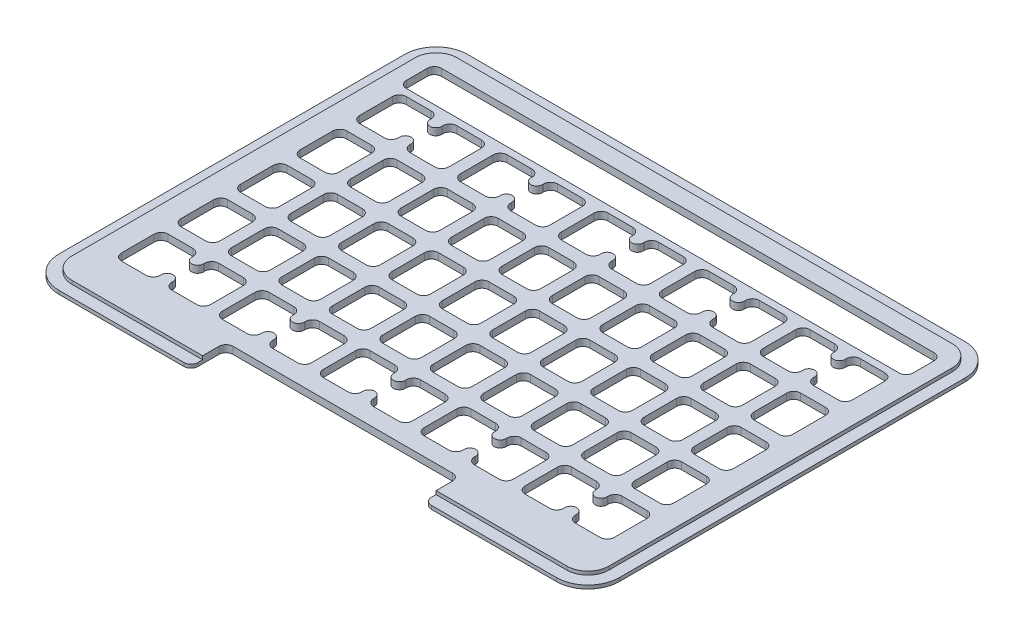
from build123d import *

# Parameters (mm, degrees)
SKETCH1_W                = 240
SKETCH1_H                = 175
OUTER_PROFILE_DEPTH      = 1.5
SKETCH2_W                = 230
SKETCH2_H                = 165
INNER_PROFILE_DEPTH      = 1.5
FILLET1_R                = 9
FILLET2_R                = 13.5
SKETCH3_W                = 16.6
SKETCH3_H                = 20
CUTOUT_DEPTH             = 149.543764595
CORNERS_R                = 3
CUTOUTS_COUNT            = 5
CUTOUTS_PITCH            = 21.6
CUTOUTS_COUNT_DIR2       = 5
CUTOUTS_PITCH_DIR2       = 25.5
CORNERS_OF_CUTOUTS_R     = 3
MIRROR1_DEPTH            = 3
SKETCH4_W                = 217
SKETCH4_H                = 15
MESSAGE_WINDOW_DEPTH     = 149.543764595
MESSAGE_WINDOW_CORNERS_R = 3
CELL_SPLIT_DEPTH         = 149.543764595
CELL_SPLITS_COUNT        = 5
CELL_SPLITS_PITCH        = 43.2
CELL_SPLITS_COUNT_DIR2   = 2
CELL_SPLITS_PITCH_DIR2   = 102
SKETCH6_W                = 100
SKETCH6_H                = 15
BASE_CUTBACK_DEPTH       = 149.543764595
FILLET5_R                = 3


# Read off the part's stored shape, not the designer's step: Mirror1
with BuildPart() as part:
    # Sketch1 → Outer Profile (new body)
    with BuildSketch(Plane(origin=(0, 0, 0), x_dir=(1, 0, 0), z_dir=(0, 1, 0))):
        Rectangle(SKETCH1_W, SKETCH1_H)
    extrude(amount=OUTER_PROFILE_DEPTH)

    # Sketch2 → Inner Profile (add)
    with BuildSketch(Plane(origin=(0, 1.5, 0), x_dir=(1, 0, 0), z_dir=(0, 1, 0))):
        Rectangle(SKETCH2_W, SKETCH2_H)
    extrude(amount=INNER_PROFILE_DEPTH)

    # Fillet1
    fillet1_edges = [part.edges().sort_by_distance(p)[0] for p in [
        (115, 2.25, 82.5),
        (115, 2.25, -82.5),
        (-115, 2.25, -82.5),
        (-115, 2.25, 82.5),
    ]]
    fillet(fillet1_edges, radius=FILLET1_R)

    # Fillet2
    fillet2_edges = [part.edges().sort_by_distance(p)[0] for p in [
        (120, 0.75, 87.5),
        (-120, 0.75, 87.5),
        (-120, 0.75, -87.5),
        (120, 0.75, -87.5),
    ]]
    fillet(fillet2_edges, radius=FILLET2_R)

    # Sketch3 → Cutout (cut, through all)
    with BuildSketch(Plane(origin=(0, 3, 0), x_dir=(1, 0, 0), z_dir=(0, 1, 0))):
        with Locations((-10.8, -54.75)):
            Rectangle(SKETCH3_W, SKETCH3_H)
    cutout = extrude(amount=-CUTOUT_DEPTH, mode=Mode.SUBTRACT)

    # Corners
    corners_edges = [part.edges().sort_by_distance(p)[0] for p in [
        (-2.5, 1.5, 44.75),
        (-2.5, 1.5, 64.75),
        (-19.1, 1.5, 64.75),
        (-19.1, 1.5, 44.75),
    ]]
    fillet(corners_edges, radius=CORNERS_R)

    # Cutouts: Cutout 5 × 5
    with Locations(*[(-i * CUTOUTS_PITCH, 0, -j * CUTOUTS_PITCH_DIR2) for i in range(CUTOUTS_COUNT) for j in range(CUTOUTS_COUNT_DIR2) if (i, j) != (0, 0)]):
        add(cutout, mode=Mode.SUBTRACT)

    # Corners of Cutouts
    corners_of_cutouts_edges = [part.edges().sort_by_distance(p)[0] for p in [
        (-2.5, 1.5, 19.25),
        (-2.5, 1.5, 39.25),
        (-19.1, 1.5, 39.25),
        (-19.1, 1.5, 19.25),
        (-2.5, 1.5, -6.25),
        (-2.5, 1.5, 13.75),
        (-19.1, 1.5, 13.75),
        (-19.1, 1.5, -6.25),
        (-2.5, 1.5, -31.75),
        (-2.5, 1.5, -11.75),
        (-19.1, 1.5, -11.75),
        (-19.1, 1.5, -31.75),
        (-2.5, 1.5, -57.25),
        (-2.5, 1.5, -37.25),
        (-19.1, 1.5, -37.25),
        (-19.1, 1.5, -57.25),
        (-24.1, 1.5, 44.75),
        (-24.1, 1.5, 64.75),
        (-40.7, 1.5, 64.75),
        (-40.7, 1.5, 44.75),
        (-24.1, 1.5, 19.25),
        (-24.1, 1.5, 39.25),
        (-40.7, 1.5, 39.25),
        (-40.7, 1.5, 19.25),
        (-24.1, 1.5, -6.25),
        (-24.1, 1.5, 13.75),
        (-40.7, 1.5, 13.75),
        (-40.7, 1.5, -6.25),
        (-24.1, 1.5, -31.75),
        (-24.1, 1.5, -11.75),
        (-40.7, 1.5, -11.75),
        (-40.7, 1.5, -31.75),
        (-24.1, 1.5, -57.25),
        (-24.1, 1.5, -37.25),
        (-40.7, 1.5, -37.25),
        (-40.7, 1.5, -57.25),
        (-45.7, 1.5, 44.75),
        (-45.7, 1.5, 64.75),
        (-62.3, 1.5, 64.75),
        (-62.3, 1.5, 44.75),
        (-45.7, 1.5, 19.25),
        (-45.7, 1.5, 39.25),
        (-62.3, 1.5, 39.25),
        (-62.3, 1.5, 19.25),
        (-45.7, 1.5, -6.25),
        (-45.7, 1.5, 13.75),
        (-62.3, 1.5, 13.75),
        (-62.3, 1.5, -6.25),
        (-45.7, 1.5, -31.75),
        (-45.7, 1.5, -11.75),
        (-62.3, 1.5, -11.75),
        (-62.3, 1.5, -31.75),
        (-45.7, 1.5, -57.25),
        (-45.7, 1.5, -37.25),
        (-62.3, 1.5, -37.25),
        (-62.3, 1.5, -57.25),
        (-67.3, 1.5, 44.75),
        (-67.3, 1.5, 64.75),
        (-83.9, 1.5, 64.75),
        (-83.9, 1.5, 44.75),
        (-67.3, 1.5, 19.25),
        (-67.3, 1.5, 39.25),
        (-83.9, 1.5, 39.25),
        (-83.9, 1.5, 19.25),
        (-67.3, 1.5, -6.25),
        (-67.3, 1.5, 13.75),
        (-83.9, 1.5, 13.75),
        (-83.9, 1.5, -6.25),
        (-67.3, 1.5, -31.75),
        (-67.3, 1.5, -11.75),
        (-83.9, 1.5, -11.75),
        (-83.9, 1.5, -31.75),
        (-67.3, 1.5, -57.25),
        (-67.3, 1.5, -37.25),
        (-83.9, 1.5, -37.25),
        (-83.9, 1.5, -57.25),
        (-88.9, 1.5, 44.75),
        (-88.9, 1.5, 64.75),
        (-105.5, 1.5, 64.75),
        (-105.5, 1.5, 44.75),
        (-88.9, 1.5, 19.25),
        (-88.9, 1.5, 39.25),
        (-105.5, 1.5, 39.25),
        (-105.5, 1.5, 19.25),
        (-88.9, 1.5, -6.25),
        (-88.9, 1.5, 13.75),
        (-105.5, 1.5, 13.75),
        (-105.5, 1.5, -6.25),
        (-88.9, 1.5, -31.75),
        (-88.9, 1.5, -11.75),
        (-105.5, 1.5, -11.75),
        (-105.5, 1.5, -31.75),
        (-88.9, 1.5, -57.25),
        (-88.9, 1.5, -37.25),
        (-105.5, 1.5, -37.25),
        (-105.5, 1.5, -57.25),
    ]]
    fillet(corners_of_cutouts_edges, radius=CORNERS_OF_CUTOUTS_R)

    # Mirror1 outline → Mirror1 (cut)
    with BuildSketch(Plane(origin=(0, 0, 0), x_dir=(1, 0, 0), z_dir=(0, 1, 0))):
        with BuildLine():
            Line((5.5, -64.75), (16.1, -64.75))
            ThreePointArc((16.1, -64.75), (18.221320344, -63.871320344), (19.1, -61.75))
            Line((19.1, -61.75), (19.1, -47.75))
            ThreePointArc((19.1, -47.75), (18.221320344, -45.628679656), (16.1, -44.75))
            Line((16.1, -44.75), (5.5, -44.75))
            ThreePointArc((5.5, -44.75), (3.378679656, -45.628679656), (2.5, -47.75))
            Line((2.5, -47.75), (2.5, -61.75))
            ThreePointArc((2.5, -61.75), (3.378679656, -63.871320344), (5.5, -64.75))
        make_face()
        with BuildLine():
            Line((27.1, -64.75), (37.7, -64.75))
            ThreePointArc((37.7, -64.75), (39.821320344, -63.871320344), (40.7, -61.75))
            Line((40.7, -61.75), (40.7, -47.75))
            ThreePointArc((40.7, -47.75), (39.821320344, -45.628679656), (37.7, -44.75))
            Line((37.7, -44.75), (27.1, -44.75))
            ThreePointArc((27.1, -44.75), (24.978679656, -45.628679656), (24.1, -47.75))
            Line((24.1, -47.75), (24.1, -61.75))
            ThreePointArc((24.1, -61.75), (24.978679656, -63.871320344), (27.1, -64.75))
        make_face()
        with BuildLine():
            Line((48.7, -64.75), (59.3, -64.75))
            ThreePointArc((59.3, -64.75), (61.421320344, -63.871320344), (62.3, -61.75))
            Line((62.3, -61.75), (62.3, -47.75))
            ThreePointArc((62.3, -47.75), (61.421320344, -45.628679656), (59.3, -44.75))
            Line((59.3, -44.75), (48.7, -44.75))
            ThreePointArc((48.7, -44.75), (46.578679656, -45.628679656), (45.7, -47.75))
            Line((45.7, -47.75), (45.7, -61.75))
            ThreePointArc((45.7, -61.75), (46.578679656, -63.871320344), (48.7, -64.75))
        make_face()
        with BuildLine():
            Line((70.3, -64.75), (80.9, -64.75))
            ThreePointArc((80.9, -64.75), (83.021320344, -63.871320344), (83.9, -61.75))
            Line((83.9, -61.75), (83.9, -47.75))
            ThreePointArc((83.9, -47.75), (83.021320344, -45.628679656), (80.9, -44.75))
            Line((80.9, -44.75), (70.3, -44.75))
            ThreePointArc((70.3, -44.75), (68.178679656, -45.628679656), (67.3, -47.75))
            Line((67.3, -47.75), (67.3, -61.75))
            ThreePointArc((67.3, -61.75), (68.178679656, -63.871320344), (70.3, -64.75))
        make_face()
        with BuildLine():
            Line((91.9, -64.75), (102.5, -64.75))
            ThreePointArc((102.5, -64.75), (104.621320344, -63.871320344), (105.5, -61.75))
            Line((105.5, -61.75), (105.5, -47.75))
            ThreePointArc((105.5, -47.75), (104.621320344, -45.628679656), (102.5, -44.75))
            Line((102.5, -44.75), (91.9, -44.75))
            ThreePointArc((91.9, -44.75), (89.778679656, -45.628679656), (88.9, -47.75))
            Line((88.9, -47.75), (88.9, -61.75))
            ThreePointArc((88.9, -61.75), (89.778679656, -63.871320344), (91.9, -64.75))
        make_face()
        with BuildLine():
            Line((5.5, -39.25), (16.1, -39.25))
            ThreePointArc((16.1, -39.25), (18.221320344, -38.371320344), (19.1, -36.25))
            Line((19.1, -36.25), (19.1, -22.25))
            ThreePointArc((19.1, -22.25), (18.221320344, -20.128679656), (16.1, -19.25))
            Line((16.1, -19.25), (5.5, -19.25))
            ThreePointArc((5.5, -19.25), (3.378679656, -20.128679656), (2.5, -22.25))
            Line((2.5, -22.25), (2.5, -36.25))
            ThreePointArc((2.5, -36.25), (3.378679656, -38.371320344), (5.5, -39.25))
        make_face()
        with BuildLine():
            Line((27.1, -39.25), (37.7, -39.25))
            ThreePointArc((37.7, -39.25), (39.821320344, -38.371320344), (40.7, -36.25))
            Line((40.7, -36.25), (40.7, -22.25))
            ThreePointArc((40.7, -22.25), (39.821320344, -20.128679656), (37.7, -19.25))
            Line((37.7, -19.25), (27.1, -19.25))
            ThreePointArc((27.1, -19.25), (24.978679656, -20.128679656), (24.1, -22.25))
            Line((24.1, -22.25), (24.1, -36.25))
            ThreePointArc((24.1, -36.25), (24.978679656, -38.371320344), (27.1, -39.25))
        make_face()
        with BuildLine():
            Line((48.7, -39.25), (59.3, -39.25))
            ThreePointArc((59.3, -39.25), (61.421320344, -38.371320344), (62.3, -36.25))
            Line((62.3, -36.25), (62.3, -22.25))
            ThreePointArc((62.3, -22.25), (61.421320344, -20.128679656), (59.3, -19.25))
            Line((59.3, -19.25), (48.7, -19.25))
            ThreePointArc((48.7, -19.25), (46.578679656, -20.128679656), (45.7, -22.25))
            Line((45.7, -22.25), (45.7, -36.25))
            ThreePointArc((45.7, -36.25), (46.578679656, -38.371320344), (48.7, -39.25))
        make_face()
        with BuildLine():
            Line((70.3, -39.25), (80.9, -39.25))
            ThreePointArc((80.9, -39.25), (83.021320344, -38.371320344), (83.9, -36.25))
            Line((83.9, -36.25), (83.9, -22.25))
            ThreePointArc((83.9, -22.25), (83.021320344, -20.128679656), (80.9, -19.25))
            Line((80.9, -19.25), (70.3, -19.25))
            ThreePointArc((70.3, -19.25), (68.178679656, -20.128679656), (67.3, -22.25))
            Line((67.3, -22.25), (67.3, -36.25))
            ThreePointArc((67.3, -36.25), (68.178679656, -38.371320344), (70.3, -39.25))
        make_face()
        with BuildLine():
            Line((91.9, -39.25), (102.5, -39.25))
            ThreePointArc((102.5, -39.25), (104.621320344, -38.371320344), (105.5, -36.25))
            Line((105.5, -36.25), (105.5, -22.25))
            ThreePointArc((105.5, -22.25), (104.621320344, -20.128679656), (102.5, -19.25))
            Line((102.5, -19.25), (91.9, -19.25))
            ThreePointArc((91.9, -19.25), (89.778679656, -20.128679656), (88.9, -22.25))
            Line((88.9, -22.25), (88.9, -36.25))
            ThreePointArc((88.9, -36.25), (89.778679656, -38.371320344), (91.9, -39.25))
        make_face()
        with BuildLine():
            Line((5.5, -13.75), (16.1, -13.75))
            ThreePointArc((16.1, -13.75), (18.221320344, -12.871320344), (19.1, -10.75))
            Line((19.1, -10.75), (19.1, 3.25))
            ThreePointArc((19.1, 3.25), (18.221320344, 5.371320344), (16.1, 6.25))
            Line((16.1, 6.25), (5.5, 6.25))
            ThreePointArc((5.5, 6.25), (3.378679656, 5.371320344), (2.5, 3.25))
            Line((2.5, 3.25), (2.5, -10.75))
            ThreePointArc((2.5, -10.75), (3.378679656, -12.871320344), (5.5, -13.75))
        make_face()
        with BuildLine():
            Line((27.1, -13.75), (37.7, -13.75))
            ThreePointArc((37.7, -13.75), (39.821320344, -12.871320344), (40.7, -10.75))
            Line((40.7, -10.75), (40.7, 3.25))
            ThreePointArc((40.7, 3.25), (39.821320344, 5.371320344), (37.7, 6.25))
            Line((37.7, 6.25), (27.1, 6.25))
            ThreePointArc((27.1, 6.25), (24.978679656, 5.371320344), (24.1, 3.25))
            Line((24.1, 3.25), (24.1, -10.75))
            ThreePointArc((24.1, -10.75), (24.978679656, -12.871320344), (27.1, -13.75))
        make_face()
        with BuildLine():
            Line((48.7, -13.75), (59.3, -13.75))
            ThreePointArc((59.3, -13.75), (61.421320344, -12.871320344), (62.3, -10.75))
            Line((62.3, -10.75), (62.3, 3.25))
            ThreePointArc((62.3, 3.25), (61.421320344, 5.371320344), (59.3, 6.25))
            Line((59.3, 6.25), (48.7, 6.25))
            ThreePointArc((48.7, 6.25), (46.578679656, 5.371320344), (45.7, 3.25))
            Line((45.7, 3.25), (45.7, -10.75))
            ThreePointArc((45.7, -10.75), (46.578679656, -12.871320344), (48.7, -13.75))
        make_face()
        with BuildLine():
            Line((70.3, -13.75), (80.9, -13.75))
            ThreePointArc((80.9, -13.75), (83.021320344, -12.871320344), (83.9, -10.75))
            Line((83.9, -10.75), (83.9, 3.25))
            ThreePointArc((83.9, 3.25), (83.021320344, 5.371320344), (80.9, 6.25))
            Line((80.9, 6.25), (70.3, 6.25))
            ThreePointArc((70.3, 6.25), (68.178679656, 5.371320344), (67.3, 3.25))
            Line((67.3, 3.25), (67.3, -10.75))
            ThreePointArc((67.3, -10.75), (68.178679656, -12.871320344), (70.3, -13.75))
        make_face()
        with BuildLine():
            Line((91.9, -13.75), (102.5, -13.75))
            ThreePointArc((102.5, -13.75), (104.621320344, -12.871320344), (105.5, -10.75))
            Line((105.5, -10.75), (105.5, 3.25))
            ThreePointArc((105.5, 3.25), (104.621320344, 5.371320344), (102.5, 6.25))
            Line((102.5, 6.25), (91.9, 6.25))
            ThreePointArc((91.9, 6.25), (89.778679656, 5.371320344), (88.9, 3.25))
            Line((88.9, 3.25), (88.9, -10.75))
            ThreePointArc((88.9, -10.75), (89.778679656, -12.871320344), (91.9, -13.75))
        make_face()
        with BuildLine():
            Line((5.5, 11.75), (16.1, 11.75))
            ThreePointArc((16.1, 11.75), (18.221320344, 12.628679656), (19.1, 14.75))
            Line((19.1, 14.75), (19.1, 28.75))
            ThreePointArc((19.1, 28.75), (18.221320344, 30.871320344), (16.1, 31.75))
            Line((16.1, 31.75), (5.5, 31.75))
            ThreePointArc((5.5, 31.75), (3.378679656, 30.871320344), (2.5, 28.75))
            Line((2.5, 28.75), (2.5, 14.75))
            ThreePointArc((2.5, 14.75), (3.378679656, 12.628679656), (5.5, 11.75))
        make_face()
        with BuildLine():
            Line((27.1, 11.75), (37.7, 11.75))
            ThreePointArc((37.7, 11.75), (39.821320344, 12.628679656), (40.7, 14.75))
            Line((40.7, 14.75), (40.7, 28.75))
            ThreePointArc((40.7, 28.75), (39.821320344, 30.871320344), (37.7, 31.75))
            Line((37.7, 31.75), (27.1, 31.75))
            ThreePointArc((27.1, 31.75), (24.978679656, 30.871320344), (24.1, 28.75))
            Line((24.1, 28.75), (24.1, 14.75))
            ThreePointArc((24.1, 14.75), (24.978679656, 12.628679656), (27.1, 11.75))
        make_face()
        with BuildLine():
            Line((48.7, 11.75), (59.3, 11.75))
            ThreePointArc((59.3, 11.75), (61.421320344, 12.628679656), (62.3, 14.75))
            Line((62.3, 14.75), (62.3, 28.75))
            ThreePointArc((62.3, 28.75), (61.421320344, 30.871320344), (59.3, 31.75))
            Line((59.3, 31.75), (48.7, 31.75))
            ThreePointArc((48.7, 31.75), (46.578679656, 30.871320344), (45.7, 28.75))
            Line((45.7, 28.75), (45.7, 14.75))
            ThreePointArc((45.7, 14.75), (46.578679656, 12.628679656), (48.7, 11.75))
        make_face()
        with BuildLine():
            Line((70.3, 11.75), (80.9, 11.75))
            ThreePointArc((80.9, 11.75), (83.021320344, 12.628679656), (83.9, 14.75))
            Line((83.9, 14.75), (83.9, 28.75))
            ThreePointArc((83.9, 28.75), (83.021320344, 30.871320344), (80.9, 31.75))
            Line((80.9, 31.75), (70.3, 31.75))
            ThreePointArc((70.3, 31.75), (68.178679656, 30.871320344), (67.3, 28.75))
            Line((67.3, 28.75), (67.3, 14.75))
            ThreePointArc((67.3, 14.75), (68.178679656, 12.628679656), (70.3, 11.75))
        make_face()
        with BuildLine():
            Line((91.9, 11.75), (102.5, 11.75))
            ThreePointArc((102.5, 11.75), (104.621320344, 12.628679656), (105.5, 14.75))
            Line((105.5, 14.75), (105.5, 28.75))
            ThreePointArc((105.5, 28.75), (104.621320344, 30.871320344), (102.5, 31.75))
            Line((102.5, 31.75), (91.9, 31.75))
            ThreePointArc((91.9, 31.75), (89.778679656, 30.871320344), (88.9, 28.75))
            Line((88.9, 28.75), (88.9, 14.75))
            ThreePointArc((88.9, 14.75), (89.778679656, 12.628679656), (91.9, 11.75))
        make_face()
        with BuildLine():
            Line((5.5, 37.25), (16.1, 37.25))
            ThreePointArc((16.1, 37.25), (18.221320344, 38.128679656), (19.1, 40.25))
            Line((19.1, 40.25), (19.1, 54.25))
            ThreePointArc((19.1, 54.25), (18.221320344, 56.371320344), (16.1, 57.25))
            Line((16.1, 57.25), (5.5, 57.25))
            ThreePointArc((5.5, 57.25), (3.378679656, 56.371320344), (2.5, 54.25))
            Line((2.5, 54.25), (2.5, 40.25))
            ThreePointArc((2.5, 40.25), (3.378679656, 38.128679656), (5.5, 37.25))
        make_face()
        with BuildLine():
            Line((27.1, 37.25), (37.7, 37.25))
            ThreePointArc((37.7, 37.25), (39.821320344, 38.128679656), (40.7, 40.25))
            Line((40.7, 40.25), (40.7, 54.25))
            ThreePointArc((40.7, 54.25), (39.821320344, 56.371320344), (37.7, 57.25))
            Line((37.7, 57.25), (27.1, 57.25))
            ThreePointArc((27.1, 57.25), (24.978679656, 56.371320344), (24.1, 54.25))
            Line((24.1, 54.25), (24.1, 40.25))
            ThreePointArc((24.1, 40.25), (24.978679656, 38.128679656), (27.1, 37.25))
        make_face()
        with BuildLine():
            Line((48.7, 37.25), (59.3, 37.25))
            ThreePointArc((59.3, 37.25), (61.421320344, 38.128679656), (62.3, 40.25))
            Line((62.3, 40.25), (62.3, 54.25))
            ThreePointArc((62.3, 54.25), (61.421320344, 56.371320344), (59.3, 57.25))
            Line((59.3, 57.25), (48.7, 57.25))
            ThreePointArc((48.7, 57.25), (46.578679656, 56.371320344), (45.7, 54.25))
            Line((45.7, 54.25), (45.7, 40.25))
            ThreePointArc((45.7, 40.25), (46.578679656, 38.128679656), (48.7, 37.25))
        make_face()
        with BuildLine():
            Line((70.3, 37.25), (80.9, 37.25))
            ThreePointArc((80.9, 37.25), (83.021320344, 38.128679656), (83.9, 40.25))
            Line((83.9, 40.25), (83.9, 54.25))
            ThreePointArc((83.9, 54.25), (83.021320344, 56.371320344), (80.9, 57.25))
            Line((80.9, 57.25), (70.3, 57.25))
            ThreePointArc((70.3, 57.25), (68.178679656, 56.371320344), (67.3, 54.25))
            Line((67.3, 54.25), (67.3, 40.25))
            ThreePointArc((67.3, 40.25), (68.178679656, 38.128679656), (70.3, 37.25))
        make_face()
        with BuildLine():
            Line((91.9, 37.25), (102.5, 37.25))
            ThreePointArc((102.5, 37.25), (104.621320344, 38.128679656), (105.5, 40.25))
            Line((105.5, 40.25), (105.5, 54.25))
            ThreePointArc((105.5, 54.25), (104.621320344, 56.371320344), (102.5, 57.25))
            Line((102.5, 57.25), (91.9, 57.25))
            ThreePointArc((91.9, 57.25), (89.778679656, 56.371320344), (88.9, 54.25))
            Line((88.9, 54.25), (88.9, 40.25))
            ThreePointArc((88.9, 40.25), (89.778679656, 38.128679656), (91.9, 37.25))
        make_face()
    extrude(amount=MIRROR1_DEPTH, mode=Mode.SUBTRACT)

    # Sketch4 → Message Window (cut, through all)
    with BuildSketch(Plane(origin=(0, 3, 0), x_dir=(1, 0, 0), z_dir=(0, 1, 0))):
        with Locations((0, 67.75)):
            Rectangle(SKETCH4_W, SKETCH4_H)
    extrude(amount=-MESSAGE_WINDOW_DEPTH, mode=Mode.SUBTRACT)

    # Message Window Corners
    message_window_corners_edges = [part.edges().sort_by_distance(p)[0] for p in [
        (-108.5, 1.5, -60.25),
        (-108.5, 1.5, -75.25),
        (108.5, 1.5, -75.25),
        (108.5, 1.5, -60.25),
    ]]
    fillet(message_window_corners_edges, radius=MESSAGE_WINDOW_CORNERS_R)

    # Sketch5 → Cell Split (cut, through all)
    with BuildSketch(Plane(origin=(0, 3, 0), x_dir=(1, 0, 0), z_dir=(0, 1, 0))):
        with BuildLine():
            Line((-88.9, 53.75), (-88.9, 40.75))
            ThreePointArc((-88.9, 40.75), (-86.4, 43.25), (-83.9, 40.75))
            Line((-83.9, 40.75), (-83.9, 53.75))
            ThreePointArc((-83.9, 53.75), (-86.4, 51.25), (-88.9, 53.75))
        make_face()
    cell_split = extrude(amount=-CELL_SPLIT_DEPTH, mode=Mode.SUBTRACT)

    # Cell Splits: Cell Split 5 × 2
    with Locations(*[(i * CELL_SPLITS_PITCH, 0, j * CELL_SPLITS_PITCH_DIR2) for i in range(CELL_SPLITS_COUNT) for j in range(CELL_SPLITS_COUNT_DIR2) if (i, j) != (0, 0)]):
        add(cell_split, mode=Mode.SUBTRACT)

    # Sketch6 → Base Cutback (cut, through all)
    with BuildSketch(Plane(origin=(0, 3, 0), x_dir=(1, 0, 0), z_dir=(0, 1, 0))):
        with Locations((0, -80)):
            Rectangle(SKETCH6_W, SKETCH6_H)
    extrude(amount=-BASE_CUTBACK_DEPTH, mode=Mode.SUBTRACT)

    # Fillet5
    fillet5_edges = [part.edges().sort_by_distance(p)[0] for p in [
        (50, 0.75, 87.5),
        (50, 1.5, 72.5),
        (-50, 0.75, 87.5),
        (-50, 1.5, 72.5),
    ]]
    fillet(fillet5_edges, radius=FILLET5_R)


solid = part.part
